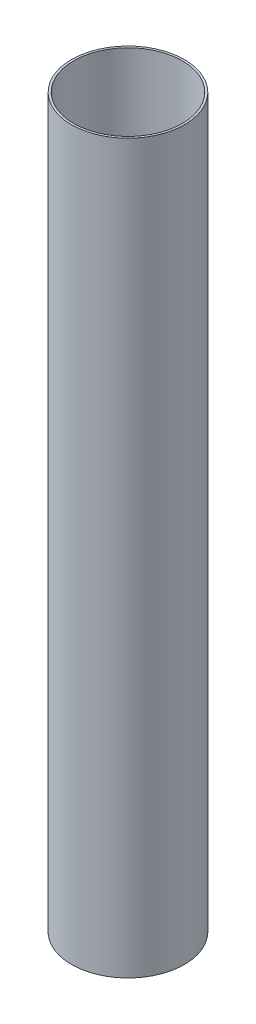
from build123d import *

# Parameters (mm, degrees)
SKETCH1_R           = 39.6
SKETCH1_R_2         = 38.1
BOSS_EXTRUDE1_DEPTH = 510


with BuildPart() as part:
    # Sketch1 → Boss-Extrude1 (new body)
    with BuildSketch(Plane(origin=(0, 0, 0), x_dir=(1, 0, 0), z_dir=(0, 1, 0))):
        Circle(SKETCH1_R)
        Circle(SKETCH1_R_2, mode=Mode.SUBTRACT)
    extrude(amount=BOSS_EXTRUDE1_DEPTH)


solid = part.part
